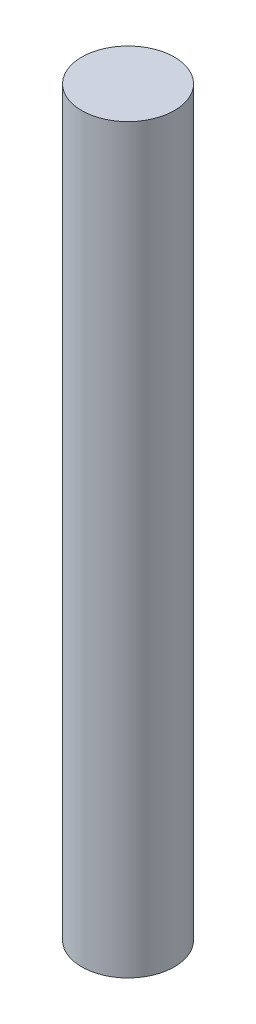
from build123d import *

# Parameters (mm, degrees)
SKETCH1_R           = 9.525
BOSS_EXTRUDE1_DEPTH = 76.2


with BuildPart() as part:
    # Sketch1 → Boss-Extrude1 (new, symmetric)
    with BuildSketch(Plane(origin=(0, 0, 0), x_dir=(1, 0, 0), z_dir=(0, 1, 0))):
        Circle(SKETCH1_R)
    extrude(amount=BOSS_EXTRUDE1_DEPTH, both=True)


solid = part.part
